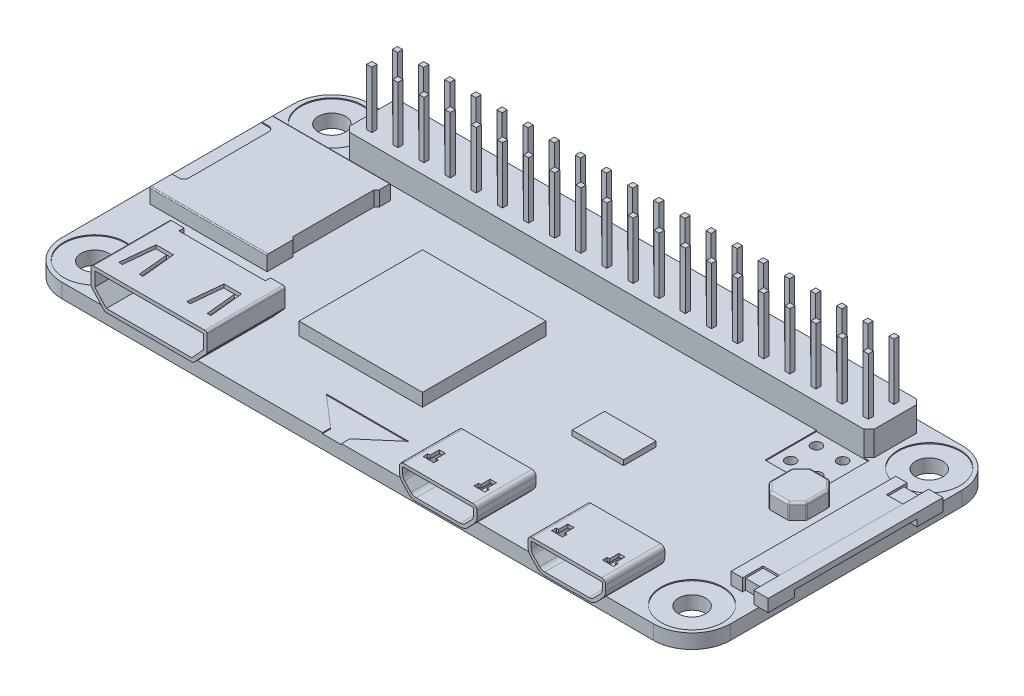
from build123d import *

# Parameters (mm, degrees)
BOSS_EXTRUDE1_DEPTH      = 1.4
SKETCH2_R                = 1.325
CUT_EXTRUDE1_DEPTH       = 36.821920663
SKETCH3_R                = 0.5
CUT_EXTRUDE2_DEPTH       = 36.821920663
LPATTERN1_COUNT          = 20
LPATTERN1_PITCH          = 2.54
SKETCH5_R                = 0.5
CUT_EXTRUDE4_DEPTH       = 36.821920663
SKETCH4_R                = 3
CUT_EXTRUDE3_DEPTH       = 0.1
SKETCH6_W                = 12
SKETCH6_H                = 12
BOSS_EXTRUDE2_DEPTH      = 1.25
BOSS_EXTRUDE3_DEPTH      = 1.45
FILLET2_R                = 0.1
CUT_EXTRUDE5_DEPTH       = 65.240816464
CUT_EXTRUDE5_DEPTH_BACK  = 9.5
SKETCH8_W                = 11.8
SKETCH8_H                = 1.25
BOSS_EXTRUDE4_DEPTH      = 0.4
BOSS_EXTRUDE4_DEPTH_BACK = 7.2
FILLET1_R                = 0.2
CUT_EXTRUDE6_DEPTH       = 7
SKETCH11_W               = 7
SKETCH11_H               = 0.55
BOSS_EXTRUDE5_DEPTH      = 3.5
CUT_EXTRUDE7_DEPTH       = 37.226130072
SKETCH13_W               = 8.4
SKETCH13_H               = 1.4
CUT_EXTRUDE8_DEPTH       = 0.5
BOSS_EXTRUDE6_DEPTH      = 1.25
BOSS_EXTRUDE6_DEPTH_BACK = 4.5
CUT_EXTRUDE9_DEPTH       = 5.25
SKETCH17_W               = 3.15
SKETCH17_H               = 0.4
BOSS_EXTRUDE7_DEPTH      = 3.5
CUT_EXTRUDE10_DEPTH      = 0.32
BOSS_EXTRUDE8_DEPTH      = 0.9
BOSS_EXTRUDE8_DEPTH_BACK = 0.5
BOSS_EXTRUDE9_DEPTH      = 1.19
SKETCH21_W               = 1.6
SKETCH21_H               = 1.7
BOSS_EXTRUDE10_DEPTH     = 1
SKETCH22_W               = 3.65
SKETCH22_H               = 4
BOSS_EXTRUDE11_DEPTH     = 1.5
CHAMFER1_SIZE            = 0.9
SKETCH23_W               = 5
SKETCH23_H               = 3.15
BOSS_EXTRUDE12_DEPTH     = 0.5
FILLET3_R                = 0.2
SKETCH_1_R               = 0.75
SKETCH_1_R_2             = 0.6
EXTRUDE_1_DEPTH          = 0.1
SKETCH_2_W               = 0.5
SKETCH_2_H               = 0.5
EXTRUDE_2_DEPTH          = 8
EXTRUDE_2_2_DEPTH        = 8
EXTRUDE_2_3_DEPTH        = 8
EXTRUDE_2_4_DEPTH        = 8
EXTRUDE_2_5_DEPTH        = 8
EXTRUDE_2_6_DEPTH        = 8
EXTRUDE_2_7_DEPTH        = 8
EXTRUDE_2_8_DEPTH        = 8
EXTRUDE_2_9_DEPTH        = 8
EXTRUDE_2_10_DEPTH       = 8
EXTRUDE_2_11_DEPTH       = 8
EXTRUDE_2_12_DEPTH       = 8
EXTRUDE_2_13_DEPTH       = 8
EXTRUDE_2_14_DEPTH       = 8
EXTRUDE_2_15_DEPTH       = 8
EXTRUDE_2_16_DEPTH       = 8
EXTRUDE_2_17_DEPTH       = 8
EXTRUDE_2_18_DEPTH       = 8
EXTRUDE_2_19_DEPTH       = 8
EXTRUDE_2_20_DEPTH       = 8
EXTRUDE_2_21_DEPTH       = 8
EXTRUDE_2_22_DEPTH       = 8
EXTRUDE_2_23_DEPTH       = 8
EXTRUDE_2_24_DEPTH       = 8
EXTRUDE_2_25_DEPTH       = 8
EXTRUDE_2_26_DEPTH       = 8
EXTRUDE_2_27_DEPTH       = 8
EXTRUDE_2_28_DEPTH       = 8
EXTRUDE_2_29_DEPTH       = 8
EXTRUDE_2_30_DEPTH       = 8
EXTRUDE_2_31_DEPTH       = 8
EXTRUDE_2_32_DEPTH       = 8
EXTRUDE_2_33_DEPTH       = 8
EXTRUDE_2_34_DEPTH       = 8
EXTRUDE_2_35_DEPTH       = 8
EXTRUDE_2_36_DEPTH       = 8
EXTRUDE_2_37_DEPTH       = 8
EXTRUDE_2_38_DEPTH       = 8
EXTRUDE_2_39_DEPTH       = 8
EXTRUDE_2_40_DEPTH       = 8
SKETCH_3_W               = 51
SKETCH_3_H               = 5.1
EXTRUDE_3_DEPTH          = 2.5
CHAMFER_1_SIZE           = 0.5


with BuildPart() as part:
    # Sketch1 → Boss-Extrude1 (new body)
    with BuildSketch(Plane(origin=(0, 0, 0), x_dir=(1, 0, 0), z_dir=(0, 1, 0))):
        with BuildLine():
            Line((-28.75, 15), (28.75, 15))
            ThreePointArc((28.75, 15), (31.401650429, 13.901650429), (32.5, 11.25))
            Line((32.5, 11.25), (32.5, -11.25))
            ThreePointArc((32.5, -11.25), (31.401650429, -13.901650429), (28.75, -15))
            Line((28.75, -15), (-28.75, -15))
            ThreePointArc((-28.75, -15), (-31.401650429, -13.901650429), (-32.5, -11.25))
            Line((-32.5, -11.25), (-32.5, 11.25))
            ThreePointArc((-32.5, 11.25), (-31.401650429, 13.901650429), (-28.75, 15))
        make_face()
    extrude(amount=BOSS_EXTRUDE1_DEPTH)

    # Sketch2 → Cut-Extrude1 (cut, through all)
    with BuildSketch(Plane(origin=(0, 1.4, 0), x_dir=(1, 0, 0), z_dir=(0, 1, 0))):
        with Locations(Location((-29.025, 11.525, 0), (0, 0, 270))):
            Circle(SKETCH2_R)
        with Locations(Location((29.025, 11.525, 0), (0, 0, 90))):
            Circle(SKETCH2_R)
        with Locations(Location((29.025, -11.525, 0), (0, 0, 270))):
            Circle(SKETCH2_R)
        with Locations(Location((-29.025, -11.525, 0), (0, 0, 90))):
            Circle(SKETCH2_R)
    extrude(amount=-CUT_EXTRUDE1_DEPTH, mode=Mode.SUBTRACT)

    # Sketch3 → Cut-Extrude2 (cut, through all)
    with BuildSketch(Plane(origin=(0, 1.4, 0), x_dir=(1, 0, 0), z_dir=(0, 1, 0))):
        with Locations(Location((-24.128, 13, 0), (0, 0, 270))):
            Circle(SKETCH3_R)
        with Locations(Location((-24.128, 10.5, 0), (0, 0, 270))):
            Circle(SKETCH3_R)
    cut_extrude2 = extrude(amount=-CUT_EXTRUDE2_DEPTH, mode=Mode.SUBTRACT)

    # LPattern1: Cut-Extrude2 ×20
    with Locations(*[(i * LPATTERN1_PITCH, 0, 0) for i in range(1, LPATTERN1_COUNT)]):
        add(cut_extrude2, mode=Mode.SUBTRACT)

    # Sketch5 → Cut-Extrude4 (cut, through all)
    with BuildSketch(Plane(origin=(0, 1.4, 0), x_dir=(1, 0, 0), z_dir=(0, 1, 0))):
        with Locations(Location((21.592, 5.5, 0), (0, 0, 270))):
            Circle(SKETCH5_R)
        with Locations(Location((24.132, 5.5, 0), (0, 0, 270))):
            Circle(SKETCH5_R)
        with Locations(Location((21.592, 8, 0), (0, 0, 270))):
            Circle(SKETCH5_R)
        with Locations(Location((24.132, 8, 0), (0, 0, 270))):
            Circle(SKETCH5_R)
    extrude(amount=-CUT_EXTRUDE4_DEPTH, mode=Mode.SUBTRACT)

    # Sketch4 → Cut-Extrude3 (cut)
    with BuildSketch(Plane(origin=(0, 1.4, 0), x_dir=(1, 0, 0), z_dir=(0, 1, 0))):
        with Locations(Location((-29.025, 11.525, 0), (0, 0, 270))):
            Circle(SKETCH4_R)
        with Locations(Location((-29.025, -11.525, 0), (0, 0, 270))):
            Circle(SKETCH4_R)
        with Locations(Location((29.025, -11.525, 0), (0, 0, 270))):
            Circle(SKETCH4_R)
        with Locations(Location((29.025, 11.525, 0), (0, 0, 270))):
            Circle(SKETCH4_R)
        Polygon((-25.5, 14.3), (25.5, 14.3), (25.5, 9.2), (25.5, 4.2), (20.4, 4.2), (20.4, 9.2), (-25.5, 9.2), align=None)
        Polygon((-6.5, -11.55), (1.5, -11.55), (-1.575, -14.2), (-1.575, -15), (-3.425, -15), (-3.425, -14.2), align=None)
    extrude(amount=-CUT_EXTRUDE3_DEPTH, mode=Mode.SUBTRACT)

    # Sketch6 → Boss-Extrude2 (add)
    with BuildSketch(Plane(origin=(0, 1.4, 0), x_dir=(1, 0, 0), z_dir=(0, 1, 0))):
        with Locations((-6.7, -2)):
            Rectangle(SKETCH6_W, SKETCH6_H)
    extrude(amount=BOSS_EXTRUDE2_DEPTH)

    # Sketch7 → Boss-Extrude3 (add)
    with BuildSketch(Plane(origin=(0, 1.4, 0), x_dir=(1, 0, 0), z_dir=(0, 1, 0))):
        with BuildLine():
            Line((-19.65, 7.85), (-19.65, 6.75))
            Line((-19.65, 6.75), (-19.9, 6.5))
            Line((-19.9, 6.5), (-19.9, -1.4))
            Line((-19.9, -1.4), (-19.65, -1.65))
            Line((-19.65, -1.65), (-19.65, -4.15))
            Line((-19.65, -4.15), (-31.05, -4.15))
            Line((-31.05, -4.15), (-31.05, -2))
            Line((-31.05, -2), (-30.4, -2))
            ThreePointArc((-30.4, -2), (-30.046446609, -1.853553391), (-29.9, -1.5))
            Line((-29.9, -1.5), (-29.9, 6.25))
            ThreePointArc((-29.9, 6.25), (-30.046446609, 6.603553391), (-30.4, 6.75))
            Line((-30.4, 6.75), (-31.05, 6.75))
            Line((-31.05, 6.75), (-31.05, 7.85))
            Line((-31.05, 7.85), (-19.65, 7.85))
        make_face()
    extrude(amount=BOSS_EXTRUDE3_DEPTH)

    # Fillet2
    fillet2_edges = [part.edges().sort_by_distance(p)[0] for p in [
        (-25.35, 2.85, 4.15),
        (-25.35, 2.85, -7.85),
    ]]
    fillet(fillet2_edges, radius=FILLET2_R)

    # Sketch8 → Cut-Extrude5 (cut, two sides: drawn at the far end of the back side and taken through both)
    with BuildSketch(Plane.ZY.offset(29.9).offset(-CUT_EXTRUDE5_DEPTH_BACK)):
        with Locations((-1.85, 2.125)):
            Rectangle(SKETCH8_W, SKETCH8_H)
    extrude(amount=CUT_EXTRUDE5_DEPTH + CUT_EXTRUDE5_DEPTH_BACK, mode=Mode.SUBTRACT)

    # Sketch15 → Boss-Extrude6 (add, two sides: drawn at the far end of the back side and taken through both)
    with BuildSketch(Plane.XY.offset(15).offset(-BOSS_EXTRUDE6_DEPTH_BACK)):
        with BuildLine():
            Line((18.2, 4), (24.95, 4))
            ThreePointArc((24.95, 4), (25.232842712, 3.882842712), (25.35, 3.6))
            Line((25.35, 3.6), (25.35, 3.052310288))
            ThreePointArc((25.35, 3.052310288), (25.277735771, 2.679072643), (25.071387321, 2.359778459))
            Line((25.071387321, 2.359778459), (24.445169445, 1.707468172))
            ThreePointArc((24.445169445, 1.707468172), (24.115871509, 1.480072876), (23.723782124, 1.4))
            Line((23.723782124, 1.4), (19.426217876, 1.4))
            ThreePointArc((19.426217876, 1.4), (19.034128491, 1.480072876), (18.704830555, 1.707468172))
            Line((18.704830555, 1.707468172), (18.078612679, 2.359778459))
            ThreePointArc((18.078612679, 2.359778459), (17.872264229, 2.679072643), (17.8, 3.052310288))
            Line((17.8, 3.052310288), (17.8, 3.6))
            ThreePointArc((17.8, 3.6), (17.917157288, 3.882842712), (18.2, 4))
        make_face()
        with BuildLine():
            Line((12.85, 3.6), (12.85, 3.052310288))
            ThreePointArc((12.85, 3.052310288), (12.777735771, 2.679072643), (12.571387321, 2.359778459))
            Line((12.571387321, 2.359778459), (11.945169445, 1.707468172))
            ThreePointArc((11.945169445, 1.707468172), (11.615871509, 1.480072876), (11.223782124, 1.4))
            Line((11.223782124, 1.4), (6.926217876, 1.4))
            ThreePointArc((6.926217876, 1.4), (6.534128491, 1.480072876), (6.204830555, 1.707468172))
            Line((6.204830555, 1.707468172), (5.578612679, 2.359778459))
            ThreePointArc((5.578612679, 2.359778459), (5.372264229, 2.679072643), (5.3, 3.052310288))
            Line((5.3, 3.052310288), (5.3, 3.6))
            ThreePointArc((5.3, 3.6), (5.417157288, 3.882842712), (5.7, 4))
            Line((5.7, 4), (12.45, 4))
            ThreePointArc((12.45, 4), (12.732842712, 3.882842712), (12.85, 3.6))
        make_face()
    extrude(amount=BOSS_EXTRUDE6_DEPTH + BOSS_EXTRUDE6_DEPTH_BACK)

    # Sketch16 → Cut-Extrude9 (cut)
    with BuildSketch(Plane.XY.offset(16.25)):
        with BuildLine():
            Line((12.45, 3.68), (5.7, 3.68))
            ThreePointArc((5.7, 3.68), (5.643431458, 3.656568542), (5.62, 3.6))
            Line((5.62, 3.6), (5.62, 3.052310288))
            ThreePointArc((5.62, 3.052310288), (5.669139676, 2.798508689), (5.809456622, 2.581388644))
            Line((5.809456622, 2.581388644), (6.435674498, 1.929078357))
            ThreePointArc((6.435674498, 1.929078357), (6.659597094, 1.774449555), (6.926217876, 1.72))
            Line((6.926217876, 1.72), (11.223782124, 1.72))
            ThreePointArc((11.223782124, 1.72), (11.490402906, 1.774449555), (11.714325502, 1.929078357))
            Line((11.714325502, 1.929078357), (12.340543378, 2.581388644))
            ThreePointArc((12.340543378, 2.581388644), (12.480860324, 2.798508689), (12.53, 3.052310288))
            Line((12.53, 3.052310288), (12.53, 3.6))
            ThreePointArc((12.53, 3.6), (12.506568542, 3.656568542), (12.45, 3.68))
        make_face()
        with BuildLine():
            Line((24.214325502, 1.929078357), (24.840543378, 2.581388644))
            ThreePointArc((24.840543378, 2.581388644), (24.980860324, 2.798508689), (25.03, 3.052310288))
            Line((25.03, 3.052310288), (25.03, 3.6))
            ThreePointArc((25.03, 3.6), (25.006568542, 3.656568542), (24.95, 3.68))
            Line((24.95, 3.68), (18.2, 3.68))
            ThreePointArc((18.2, 3.68), (18.143431458, 3.656568542), (18.12, 3.6))
            Line((18.12, 3.6), (18.12, 3.052310288))
            ThreePointArc((18.12, 3.052310288), (18.169139676, 2.798508689), (18.309456622, 2.581388644))
            Line((18.309456622, 2.581388644), (18.935674498, 1.929078357))
            ThreePointArc((18.935674498, 1.929078357), (19.159597094, 1.774449555), (19.426217876, 1.72))
            Line((19.426217876, 1.72), (23.723782124, 1.72))
            ThreePointArc((23.723782124, 1.72), (23.990402906, 1.774449555), (24.214325502, 1.929078357))
        make_face()
    extrude(amount=-CUT_EXTRUDE9_DEPTH, mode=Mode.SUBTRACT)

    # Sketch17 → Boss-Extrude7 (add)
    with BuildSketch(Plane.XY.offset(11)):
        with Locations((9.075, 3.12)):
            Rectangle(SKETCH17_W, SKETCH17_H)
        with Locations((21.575, 3.12)):
            Rectangle(SKETCH17_W, SKETCH17_H)
    extrude(amount=BOSS_EXTRUDE7_DEPTH)

    # Sketch18 → Cut-Extrude10 (cut)
    with BuildSketch(Plane(origin=(0, 4, 0), x_dir=(1, 0, 0), z_dir=(0, 1, 0))):
        Polygon((6.9, -13.37), (6.3, -13.37), (6.3, -14.27), (6.075, -14.27), (6.075, -14.72), (7.125, -14.72), (7.125, -14.27), (6.9, -14.27), align=None)
        Polygon((11.25, -13.37), (11.25, -14.27), (11.025, -14.27), (11.025, -14.72), (12.075, -14.72), (12.075, -14.27), (11.85, -14.27), (11.85, -13.37), align=None)
        Polygon((19.4, -13.37), (18.8, -13.37), (18.8, -14.27), (18.575, -14.27), (18.575, -14.72), (19.625, -14.72), (19.625, -14.27), (19.4, -14.27), align=None)
        Polygon((23.75, -13.37), (23.75, -14.27), (23.525, -14.27), (23.525, -14.72), (24.575, -14.72), (24.575, -14.27), (24.35, -14.27), (24.35, -13.37), align=None)
    extrude(amount=-CUT_EXTRUDE10_DEPTH, mode=Mode.SUBTRACT)

    # Sketch19 → Boss-Extrude8 (add, two sides: drawn at the far end of the back side and taken through both)
    with BuildSketch(Plane(origin=(32.5, 0, 0), x_dir=(0, 0, -1), z_dir=(1, 0, 0)).offset(-BOSS_EXTRUDE8_DEPTH_BACK)):
        Polygon((-8.5, 2.6), (8.5, 2.6), (8.5, 1.4), (5.95, 1.4), (5.95, 2.05), (-5.95, 2.05), (-5.95, 1.4), (-8.5, 1.4), align=None)
    extrude(amount=BOSS_EXTRUDE8_DEPTH + BOSS_EXTRUDE8_DEPTH_BACK)

    # Sketch20 → Boss-Extrude9 (add)
    with BuildSketch(Plane(origin=(0, 1.4, 0), x_dir=(1, 0, 0), z_dir=(0, 1, 0))):
        Polygon((32, 6), (30.4, 6), (30.4, 8), (29.3, 8), (29.3, -8), (30.4, -8), (30.4, -6), (32, -6), align=None)
    extrude(amount=BOSS_EXTRUDE9_DEPTH)

    # Sketch21 → Boss-Extrude10 (add)
    with BuildSketch(Plane(origin=(0, 1.4, 0), x_dir=(1, 0, 0), z_dir=(0, 1, 0))):
        with Locations((31.2, 6.85)):
            Rectangle(SKETCH21_W, SKETCH21_H)
        with Locations((31.2, -6.85)):
            Rectangle(SKETCH21_W, SKETCH21_H)
    extrude(amount=BOSS_EXTRUDE10_DEPTH)

    # Sketch22 → Boss-Extrude11 (add)
    with BuildSketch(Plane(origin=(0, 1.4, 0), x_dir=(1, 0, 0), z_dir=(0, 1, 0))):
        with Locations((25.675, 2.25)):
            Rectangle(SKETCH22_W, SKETCH22_H)
    extrude(amount=BOSS_EXTRUDE11_DEPTH)

    # Chamfer1
    # the kernel refuses this chamfer: 0.9 mm, written as the material it takes off along each edge
    with BuildSketch(Plane(origin=(23.85, 1.4, -4.25), x_dir=(0.9996219169112966, 0, -0.027495876610586487), z_dir=(0, 1, 0))) as chamfer1_piece_1:
        Polygon((CHAMFER1_SIZE * 0.999621916911, -CHAMFER1_SIZE * 0.0274958766106), (-CHAMFER1_SIZE * 0.0274958766106, -CHAMFER1_SIZE * 0.999621916911), (0, 0), align=None)
    extrude(amount=3.814514689, mode=Mode.SUBTRACT)
    with BuildSketch(Plane(origin=(23.85, 1.4, -0.25), x_dir=(0.9996219169112966, 0, 0.027495876610586487), z_dir=(0, 1, 0)), Plane(origin=(27.5, 1.4, -0.25), x_dir=(0.027495876610584467, 0, -0.9996219169112966), z_dir=(0, 1, 0)), Plane(origin=(27.5, 1.4, -4.25), x_dir=(-0.9996219169112966, 0, -0.027495876610586487), z_dir=(0, 1, 0))) as chamfer1_piece_2:
        Polygon((CHAMFER1_SIZE * 0.999621916911, CHAMFER1_SIZE * 0.0274958766106), (-CHAMFER1_SIZE * 0.0274958766106, CHAMFER1_SIZE * 0.999621916911), (0, 0), align=None)
    extrude(amount=3.814514689, mode=Mode.SUBTRACT)

    # Sketch23 → Boss-Extrude12 (add)
    with BuildSketch(Plane(origin=(0, 1.4, 0), x_dir=(1, 0, 0), z_dir=(0, 1, 0))):
        with Locations((11.5, -1.575)):
            Rectangle(SKETCH23_W, SKETCH23_H)
    extrude(amount=BOSS_EXTRUDE12_DEPTH)

    # Fillet3
    # the kernel refuses this fillet: 0.2 mm, written as the material it takes off along each edge
    with BuildSketch(Plane(origin=(24.05, 2.7, -1.232842712), x_dir=(-1, 0, 0), z_dir=(0, 1, 0))) as fillet3_piece_1_section:
        Polygon((0, 0), (FILLET3_R, 0), (FILLET3_R, FILLET3_R * 0.414213562373), (FILLET3_R * 0.707106781187, FILLET3_R * 0.707106781186), align=None)
    fillet3_piece_1 = extrude(amount=FILLET3_R, mode=Mode.PRIVATE)
    fillet3_piece_1 = fillet3_piece_1 - Plane(origin=(24.05, 2.7, -1.232842712), x_dir=(0.9238795325113632, 0, -0.38268343236490504), z_dir=(0, 1, 0)) * Sphere(FILLET3_R, mode=Mode.PRIVATE)
    add(fillet3_piece_1, mode=Mode.SUBTRACT)
    with BuildSketch(Plane(origin=(24.05, 2.7, -3.267157288), x_dir=(-0.7071067811868302, 0, -0.7071067811862648), z_dir=(0, 1, 0))) as fillet3_piece_2_section:
        Polygon((0, 0), (FILLET3_R, 0), (FILLET3_R, FILLET3_R * 0.414213562373), (FILLET3_R * 0.707106781187, FILLET3_R * 0.707106781186), align=None)
    fillet3_piece_2 = extrude(amount=FILLET3_R, mode=Mode.PRIVATE)
    fillet3_piece_2 = fillet3_piece_2 - Plane(origin=(24.05, 2.7, -3.267157288), x_dir=(0.9238795325113632, 0, 0.38268343236490504), z_dir=(0, 1, 0)) * Sphere(FILLET3_R, mode=Mode.PRIVATE)
    add(fillet3_piece_2, mode=Mode.SUBTRACT)
    with BuildSketch(Plane(origin=(24.832842712, 2.7, -4.05), x_dir=(0, 0, -1), z_dir=(0, 1, 0))) as fillet3_piece_3_section:
        Polygon((0, 0), (FILLET3_R, 0), (FILLET3_R, FILLET3_R * 0.414213562373), (FILLET3_R * 0.707106781186, FILLET3_R * 0.707106781187), align=None)
    fillet3_piece_3 = extrude(amount=FILLET3_R, mode=Mode.PRIVATE)
    fillet3_piece_3 = fillet3_piece_3 - Plane(origin=(24.832842712, 2.7, -4.05), x_dir=(0.38268343236527447, 0, 0.9238795325112102), z_dir=(0, 1, 0)) * Sphere(FILLET3_R, mode=Mode.PRIVATE)
    add(fillet3_piece_3, mode=Mode.SUBTRACT)
    with BuildSketch(Plane(origin=(26.517157288, 2.7, -4.05), x_dir=(0, 0, -1), z_dir=(0, 1, 0))) as fillet3_piece_4_section:
        Polygon((0, 0), (FILLET3_R, 0), (FILLET3_R, -FILLET3_R * 0.414213562373), (FILLET3_R * 0.707106781186, -FILLET3_R * 0.707106781187), align=None)
    fillet3_piece_4 = extrude(amount=FILLET3_R, mode=Mode.PRIVATE)
    fillet3_piece_4 = fillet3_piece_4 - Plane(origin=(26.517157288, 2.7, -4.05), x_dir=(-0.38268343236527447, 0, 0.9238795325112102), z_dir=(0, 1, 0)) * Sphere(FILLET3_R, mode=Mode.PRIVATE)
    add(fillet3_piece_4, mode=Mode.SUBTRACT)
    with BuildSketch(Plane(origin=(26.517157288, 2.7, -0.45), x_dir=(0, 0, 1), z_dir=(0, 1, 0))) as fillet3_piece_5_section:
        Polygon((0, 0), (FILLET3_R, 0), (FILLET3_R, FILLET3_R * 0.414213562373), (FILLET3_R * 0.707106781187, FILLET3_R * 0.707106781186), align=None)
    fillet3_piece_5 = extrude(amount=FILLET3_R, mode=Mode.PRIVATE)
    fillet3_piece_5 = fillet3_piece_5 - Plane(origin=(26.517157288, 2.7, -0.45), x_dir=(-0.3826834323649051, 0, -0.9238795325113633), z_dir=(0, 1, 0)) * Sphere(FILLET3_R, mode=Mode.PRIVATE)
    add(fillet3_piece_5, mode=Mode.SUBTRACT)
    with BuildSketch(Plane(origin=(24.832842712, 2.7, -0.45), x_dir=(0, 0, 1), z_dir=(0, 1, 0))) as fillet3_piece_6_section:
        Polygon((0, 0), (FILLET3_R, 0), (FILLET3_R, -FILLET3_R * 0.414213562373), (FILLET3_R * 0.707106781186, -FILLET3_R * 0.707106781187), align=None)
    fillet3_piece_6 = extrude(amount=FILLET3_R, mode=Mode.PRIVATE)
    fillet3_piece_6 = fillet3_piece_6 - Plane(origin=(24.832842712, 2.7, -0.45), x_dir=(0.38268343236527447, 0, -0.9238795325112102), z_dir=(0, 1, 0)) * Sphere(FILLET3_R, mode=Mode.PRIVATE)
    add(fillet3_piece_6, mode=Mode.SUBTRACT)
    with BuildSketch(Plane(origin=(27.3, 2.7, -3.267157288), x_dir=(0.7071067811868302, 0, -0.7071067811862648), z_dir=(0, 1, 0))) as fillet3_piece_7_section:
        Polygon((0, 0), (FILLET3_R, 0), (FILLET3_R, -FILLET3_R * 0.414213562373), (FILLET3_R * 0.707106781187, -FILLET3_R * 0.707106781186), align=None)
    fillet3_piece_7 = extrude(amount=FILLET3_R, mode=Mode.PRIVATE)
    fillet3_piece_7 = fillet3_piece_7 - Plane(origin=(27.3, 2.7, -3.267157288), x_dir=(-0.9238795325113632, 0, 0.38268343236490504), z_dir=(0, 1, 0)) * Sphere(FILLET3_R, mode=Mode.PRIVATE)
    add(fillet3_piece_7, mode=Mode.SUBTRACT)
    with BuildSketch(Plane(origin=(27.3, 2.7, -1.232842712), x_dir=(1, 0, 0), z_dir=(0, 1, 0))) as fillet3_piece_8_section:
        Polygon((0, 0), (FILLET3_R, 0), (FILLET3_R, -FILLET3_R * 0.414213562373), (FILLET3_R * 0.707106781186, -FILLET3_R * 0.707106781187), align=None)
    fillet3_piece_8 = extrude(amount=FILLET3_R, mode=Mode.PRIVATE)
    fillet3_piece_8 = fillet3_piece_8 - Plane(origin=(27.3, 2.7, -1.232842712), x_dir=(-0.9238795325112102, 0, -0.38268343236527447), z_dir=(0, 1, 0)) * Sphere(FILLET3_R, mode=Mode.PRIVATE)
    add(fillet3_piece_8, mode=Mode.SUBTRACT)
    with BuildSketch(Plane(origin=(23.85, 2.9, -1.232842712), x_dir=(0, -1, 0), z_dir=(0, 0, -1)), Plane(origin=(27.5, 2.9, -3.267157288), x_dir=(0, -1, 0), z_dir=(0, 0, 1))) as fillet3_piece_9:
        with BuildLine():
            CenterArc((FILLET3_R, -FILLET3_R), FILLET3_R, 90, 90)
            Line((0, -FILLET3_R), (0, 0))
            Line((0, 0), (FILLET3_R, 0))
        make_face()
    extrude(amount=2.034314575, mode=Mode.SUBTRACT)
    with BuildSketch(Plane(origin=(23.85, 1.4, -1.15), x_dir=(-4.331389821029687e-12, 0, -1.0), z_dir=(0, 1, 0)), Plane(origin=(23.85, 1.4, -3.35), x_dir=(0.7071067811862634, 0, -0.7071067811868317), z_dir=(0, 1, 0)), Plane(origin=(24.75, 1.4, -4.25), x_dir=(1.0, 0, 4.299226035225122e-12), z_dir=(0, 1, 0))) as fillet3_piece_10:
        with BuildLine():
            CenterArc((FILLET3_R * 0.414213562369, -FILLET3_R), FILLET3_R, 90, 45)
            Line((-FILLET3_R * 0.292893218816, -FILLET3_R * 0.292893218811), (0, 0))
            Line((0, 0), (FILLET3_R * 0.414213562373, 0))
        make_face()
    extrude(amount=1.3, mode=Mode.SUBTRACT)
    with BuildSketch(Plane(origin=(24.832842712, 2.9, -4.25), x_dir=(0, -1, 0), z_dir=(1, 0, 0)), Plane(origin=(26.517157288, 2.9, -0.25), x_dir=(0, -1, 0), z_dir=(-1, 0, 0))) as fillet3_piece_11:
        with BuildLine():
            CenterArc((FILLET3_R, -FILLET3_R), FILLET3_R, 90, 90)
            Line((0, -FILLET3_R), (0, 0))
            Line((0, 0), (FILLET3_R, 0))
        make_face()
    extrude(amount=1.684314575, mode=Mode.SUBTRACT)
    with BuildSketch(Plane(origin=(26.6, 1.4, -4.25), x_dir=(-1.0, 0, 4.299226035225122e-12), z_dir=(0, 1, 0)), Plane(origin=(27.5, 1.4, -1.15), x_dir=(-4.331389821024788e-12, 0, -1.0), z_dir=(0, 1, 0)), Plane(origin=(27.5, 1.4, -3.35), x_dir=(-0.7071067811862634, 0, -0.7071067811868317), z_dir=(0, 1, 0)), Plane(origin=(24.75, 1.4, -0.25), x_dir=(1.0, 0, -4.38801148560968e-12), z_dir=(0, 1, 0)), Plane(origin=(26.6, 1.4, -0.25), x_dir=(0.7071067811868266, 0, -0.7071067811862685), z_dir=(0, 1, 0))) as fillet3_piece_12:
        with BuildLine():
            CenterArc((FILLET3_R * 0.414213562378, FILLET3_R), FILLET3_R, 225, 45)
            Line((-FILLET3_R * 0.292893218811, FILLET3_R * 0.292893218816), (0, 0))
            Line((0, 0), (FILLET3_R * 0.414213562373, 0))
        make_face()
    extrude(amount=1.3, mode=Mode.SUBTRACT)
    with BuildSketch(Plane(origin=(24.691421356, 2.9, -0.308578644), x_dir=(0, -1, 0), z_dir=(-0.7071067811862648, 0, -0.7071067811868302)), Plane(origin=(27.441421356, 2.9, -1.091421356), x_dir=(0, -1, 0), z_dir=(-0.7071067811868302, 0, 0.7071067811862648)), Plane(origin=(26.658578644, 2.9, -4.191421356), x_dir=(0, -1, 0), z_dir=(0.7071067811862648, 0, 0.7071067811868302))) as fillet3_piece_13:
        with BuildLine():
            CenterArc((FILLET3_R, -FILLET3_R), FILLET3_R, 90, 90)
            Line((0, -FILLET3_R), (0, 0))
            Line((0, 0), (FILLET3_R, 0))
        make_face()
    extrude(amount=1.107106781, mode=Mode.SUBTRACT)
    with BuildSketch(Plane(origin=(24.691421356, 2.9, -4.191421356), x_dir=(0, -1, 0), z_dir=(-0.7071067811862648, 0, 0.7071067811868302))) as fillet3_piece_14:
        with BuildLine():
            CenterArc((FILLET3_R, FILLET3_R), FILLET3_R, 180, 90)
            Line((0, FILLET3_R), (0, 0))
            Line((0, 0), (FILLET3_R, 0))
        make_face()
    extrude(amount=1.107106781, mode=Mode.SUBTRACT)

    # 草图1 → 凸台-拉伸1 (add)
    with BuildSketch(Plane.XZ):
        with Locations(Location((22.059044148, 8.883324517, 0), (0, 0, 90))):
            Circle(SKETCH_1_R)
        with Locations(Location((22.059044148, 11.173176165, 0), (0, 0, 90))):
            Circle(SKETCH_1_R)
        with Locations(Location((8.324578667, 12.898148812, 0), (0, 0, 90))):
            Circle(SKETCH_1_R_2)
        with Locations(Location((10.197519327, 12.898148812, 0), (0, 0, 90))):
            Circle(SKETCH_1_R_2)
    extrude(amount=EXTRUDE_1_DEPTH)



with BuildPart() as body_2:
    # Sketch9 → Boss-Extrude4 (new, two sides: drawn at the far end of the back side and taken through both)
    with BuildSketch(Plane.XY.offset(15).offset(-BOSS_EXTRUDE4_DEPTH_BACK)):
        Polygon((-25.5, 4.7), (-14.25, 4.7), (-14.25, 2.85), (-15.575, 1.4), (-24.175, 1.4), (-25.5, 2.85), align=None)
    extrude(amount=BOSS_EXTRUDE4_DEPTH + BOSS_EXTRUDE4_DEPTH_BACK)

    # Fillet1
    fillet1_edges = [body_2.edges().sort_by_distance(p)[0] for p in [
        (-25.5, 4.7, 11.6),
        (-14.25, 4.7, 11.6),
        (-14.25, 2.85, 11.6),
        (-15.575, 1.4, 11.6),
        (-24.175, 1.4, 11.6),
        (-25.5, 2.85, 11.6),
    ]]
    fillet(fillet1_edges, radius=FILLET1_R)

    # Sketch10 → Cut-Extrude6 (cut)
    with BuildSketch(Plane.XY.offset(15.4)):
        Polygon((-25.15, 4.35), (-25.15, 2.985829331), (-24.020707681, 1.75), (-15.729292319, 1.75), (-14.6, 2.985829331), (-14.6, 4.35), align=None)
    extrude(amount=-CUT_EXTRUDE6_DEPTH, mode=Mode.SUBTRACT)

    # Sketch11 → Boss-Extrude5 (add)
    with BuildSketch(Plane.XY.offset(8.4)):
        with Locations((-19.875, 3.225)):
            Rectangle(SKETCH11_W, SKETCH11_H)
    extrude(amount=BOSS_EXTRUDE5_DEPTH)

    # Sketch12 → Cut-Extrude7 (cut, through all)
    with BuildSketch(Plane.XZ.offset(-4.35)):
        Polygon((-24.025, 10.57), (-22.325, 10.57), (-22, 13.87), (-22.351693275, 13.87), (-22.642223578, 10.92), (-23.707776422, 10.92), (-23.998306725, 13.87), (-24.35, 13.87), align=None)
        Polygon((-15.725, 10.57), (-15.4, 13.87), (-15.751693275, 13.87), (-16.042223578, 10.92), (-17.107776422, 10.92), (-17.398306725, 13.87), (-17.75, 13.87), (-17.425, 10.57), align=None)
    extrude(amount=-CUT_EXTRUDE7_DEPTH, mode=Mode.SUBTRACT)

    # Sketch13 → Cut-Extrude8 (cut)
    with BuildSketch(Plane(origin=(0, 0, 7.8), x_dir=(-1, 0, 0), z_dir=(0, 0, -1))):
        with Locations((19.875, 4)):
            Rectangle(SKETCH13_W, SKETCH13_H)
    extrude(amount=-CUT_EXTRUDE8_DEPTH, mode=Mode.SUBTRACT)


with BuildPart() as body_3:
    # 草图2 → 凸台-拉伸2 (new body)
    with BuildSketch(Plane(origin=(0, 1.3, 0), x_dir=(1, 0, 0), z_dir=(0, 1, 0))):
        with Locations((-21.588, 13)):
            Rectangle(SKETCH_2_W, SKETCH_2_H)
    extrude(amount=EXTRUDE_2_DEPTH)


with BuildPart() as body_4:
    # 草图2 → Extrude 2 2 (new body)
    with BuildSketch(Plane(origin=(0, 1.3, 0), x_dir=(1, 0, 0), z_dir=(0, 1, 0))):
        with Locations((-24.128, 13)):
            Rectangle(SKETCH_2_W, SKETCH_2_H)
    extrude(amount=EXTRUDE_2_2_DEPTH)


with BuildPart() as body_5:
    # 草图2 → Extrude 2 3 (new body)
    with BuildSketch(Plane(origin=(0, 1.3, 0), x_dir=(1, 0, 0), z_dir=(0, 1, 0))):
        with Locations((-19.048, 13)):
            Rectangle(SKETCH_2_W, SKETCH_2_H)
    extrude(amount=EXTRUDE_2_3_DEPTH)


with BuildPart() as body_6:
    # 草图2 → Extrude 2 4 (new body)
    with BuildSketch(Plane(origin=(0, 1.3, 0), x_dir=(1, 0, 0), z_dir=(0, 1, 0))):
        with Locations((-16.508, 13)):
            Rectangle(SKETCH_2_W, SKETCH_2_H)
    extrude(amount=EXTRUDE_2_4_DEPTH)


with BuildPart() as body_7:
    # 草图2 → Extrude 2 5 (new body)
    with BuildSketch(Plane(origin=(0, 1.3, 0), x_dir=(1, 0, 0), z_dir=(0, 1, 0))):
        with Locations((-13.968, 13)):
            Rectangle(SKETCH_2_W, SKETCH_2_H)
    extrude(amount=EXTRUDE_2_5_DEPTH)


with BuildPart() as body_8:
    # 草图2 → Extrude 2 6 (new body)
    with BuildSketch(Plane(origin=(0, 1.3, 0), x_dir=(1, 0, 0), z_dir=(0, 1, 0))):
        with Locations((-11.428, 13)):
            Rectangle(SKETCH_2_W, SKETCH_2_H)
    extrude(amount=EXTRUDE_2_6_DEPTH)


with BuildPart() as body_9:
    # 草图2 → Extrude 2 7 (new body)
    with BuildSketch(Plane(origin=(0, 1.3, 0), x_dir=(1, 0, 0), z_dir=(0, 1, 0))):
        with Locations((-8.888, 13)):
            Rectangle(SKETCH_2_W, SKETCH_2_H)
    extrude(amount=EXTRUDE_2_7_DEPTH)


with BuildPart() as body_10:
    # 草图2 → Extrude 2 8 (new body)
    with BuildSketch(Plane(origin=(0, 1.3, 0), x_dir=(1, 0, 0), z_dir=(0, 1, 0))):
        with Locations((-6.348, 13)):
            Rectangle(SKETCH_2_W, SKETCH_2_H)
    extrude(amount=EXTRUDE_2_8_DEPTH)


with BuildPart() as body_11:
    # 草图2 → Extrude 2 9 (new body)
    with BuildSketch(Plane(origin=(0, 1.3, 0), x_dir=(1, 0, 0), z_dir=(0, 1, 0))):
        with Locations((-3.808, 13)):
            Rectangle(SKETCH_2_W, SKETCH_2_H)
    extrude(amount=EXTRUDE_2_9_DEPTH)


with BuildPart() as body_12:
    # 草图2 → Extrude 2 10 (new body)
    with BuildSketch(Plane(origin=(0, 1.3, 0), x_dir=(1, 0, 0), z_dir=(0, 1, 0))):
        with Locations((-1.268, 13)):
            Rectangle(SKETCH_2_W, SKETCH_2_H)
    extrude(amount=EXTRUDE_2_10_DEPTH)


with BuildPart() as body_13:
    # 草图2 → Extrude 2 11 (new body)
    with BuildSketch(Plane(origin=(0, 1.3, 0), x_dir=(1, 0, 0), z_dir=(0, 1, 0))):
        with Locations((1.272, 13)):
            Rectangle(SKETCH_2_W, SKETCH_2_H)
    extrude(amount=EXTRUDE_2_11_DEPTH)


with BuildPart() as body_14:
    # 草图2 → Extrude 2 12 (new body)
    with BuildSketch(Plane(origin=(0, 1.3, 0), x_dir=(1, 0, 0), z_dir=(0, 1, 0))):
        with Locations((3.812, 13)):
            Rectangle(SKETCH_2_W, SKETCH_2_H)
    extrude(amount=EXTRUDE_2_12_DEPTH)


with BuildPart() as body_15:
    # 草图2 → Extrude 2 13 (new body)
    with BuildSketch(Plane(origin=(0, 1.3, 0), x_dir=(1, 0, 0), z_dir=(0, 1, 0))):
        with Locations((6.352, 13)):
            Rectangle(SKETCH_2_W, SKETCH_2_H)
    extrude(amount=EXTRUDE_2_13_DEPTH)


with BuildPart() as body_16:
    # 草图2 → Extrude 2 14 (new body)
    with BuildSketch(Plane(origin=(0, 1.3, 0), x_dir=(1, 0, 0), z_dir=(0, 1, 0))):
        with Locations((8.892, 13)):
            Rectangle(SKETCH_2_W, SKETCH_2_H)
    extrude(amount=EXTRUDE_2_14_DEPTH)


with BuildPart() as body_17:
    # 草图2 → Extrude 2 15 (new body)
    with BuildSketch(Plane(origin=(0, 1.3, 0), x_dir=(1, 0, 0), z_dir=(0, 1, 0))):
        with Locations((11.432, 13)):
            Rectangle(SKETCH_2_W, SKETCH_2_H)
    extrude(amount=EXTRUDE_2_15_DEPTH)


with BuildPart() as body_18:
    # 草图2 → Extrude 2 16 (new body)
    with BuildSketch(Plane(origin=(0, 1.3, 0), x_dir=(1, 0, 0), z_dir=(0, 1, 0))):
        with Locations((13.972, 13)):
            Rectangle(SKETCH_2_W, SKETCH_2_H)
    extrude(amount=EXTRUDE_2_16_DEPTH)


with BuildPart() as body_19:
    # 草图2 → Extrude 2 17 (new body)
    with BuildSketch(Plane(origin=(0, 1.3, 0), x_dir=(1, 0, 0), z_dir=(0, 1, 0))):
        with Locations((16.512, 13)):
            Rectangle(SKETCH_2_W, SKETCH_2_H)
    extrude(amount=EXTRUDE_2_17_DEPTH)


with BuildPart() as body_20:
    # 草图2 → Extrude 2 18 (new body)
    with BuildSketch(Plane(origin=(0, 1.3, 0), x_dir=(1, 0, 0), z_dir=(0, 1, 0))):
        with Locations((19.052, 13)):
            Rectangle(SKETCH_2_W, SKETCH_2_H)
    extrude(amount=EXTRUDE_2_18_DEPTH)


with BuildPart() as body_21:
    # 草图2 → Extrude 2 19 (new body)
    with BuildSketch(Plane(origin=(0, 1.3, 0), x_dir=(1, 0, 0), z_dir=(0, 1, 0))):
        with Locations((21.592, 13)):
            Rectangle(SKETCH_2_W, SKETCH_2_H)
    extrude(amount=EXTRUDE_2_19_DEPTH)


with BuildPart() as body_22:
    # 草图2 → Extrude 2 20 (new body)
    with BuildSketch(Plane(origin=(0, 1.3, 0), x_dir=(1, 0, 0), z_dir=(0, 1, 0))):
        with Locations((24.132, 13)):
            Rectangle(SKETCH_2_W, SKETCH_2_H)
    extrude(amount=EXTRUDE_2_20_DEPTH)


with BuildPart() as body_23:
    # 草图2 → Extrude 2 21 (new body)
    with BuildSketch(Plane(origin=(0, 1.3, 0), x_dir=(1, 0, 0), z_dir=(0, 1, 0))):
        with Locations((-21.588, 10.5)):
            Rectangle(SKETCH_2_W, SKETCH_2_H)
    extrude(amount=EXTRUDE_2_21_DEPTH)


with BuildPart() as body_24:
    # 草图2 → Extrude 2 22 (new body)
    with BuildSketch(Plane(origin=(0, 1.3, 0), x_dir=(1, 0, 0), z_dir=(0, 1, 0))):
        with Locations((-19.048, 10.5)):
            Rectangle(SKETCH_2_W, SKETCH_2_H)
    extrude(amount=EXTRUDE_2_22_DEPTH)


with BuildPart() as body_25:
    # 草图2 → Extrude 2 23 (new body)
    with BuildSketch(Plane(origin=(0, 1.3, 0), x_dir=(1, 0, 0), z_dir=(0, 1, 0))):
        with Locations((-16.508, 10.5)):
            Rectangle(SKETCH_2_W, SKETCH_2_H)
    extrude(amount=EXTRUDE_2_23_DEPTH)


with BuildPart() as body_26:
    # 草图2 → Extrude 2 24 (new body)
    with BuildSketch(Plane(origin=(0, 1.3, 0), x_dir=(1, 0, 0), z_dir=(0, 1, 0))):
        with Locations((-13.968, 10.5)):
            Rectangle(SKETCH_2_W, SKETCH_2_H)
    extrude(amount=EXTRUDE_2_24_DEPTH)


with BuildPart() as body_27:
    # 草图2 → Extrude 2 25 (new body)
    with BuildSketch(Plane(origin=(0, 1.3, 0), x_dir=(1, 0, 0), z_dir=(0, 1, 0))):
        with Locations((-11.428, 10.5)):
            Rectangle(SKETCH_2_W, SKETCH_2_H)
    extrude(amount=EXTRUDE_2_25_DEPTH)


with BuildPart() as body_28:
    # 草图2 → Extrude 2 26 (new body)
    with BuildSketch(Plane(origin=(0, 1.3, 0), x_dir=(1, 0, 0), z_dir=(0, 1, 0))):
        with Locations((-8.888, 10.5)):
            Rectangle(SKETCH_2_W, SKETCH_2_H)
    extrude(amount=EXTRUDE_2_26_DEPTH)


with BuildPart() as body_29:
    # 草图2 → Extrude 2 27 (new body)
    with BuildSketch(Plane(origin=(0, 1.3, 0), x_dir=(1, 0, 0), z_dir=(0, 1, 0))):
        with Locations((-6.348, 10.5)):
            Rectangle(SKETCH_2_W, SKETCH_2_H)
    extrude(amount=EXTRUDE_2_27_DEPTH)


with BuildPart() as body_30:
    # 草图2 → Extrude 2 28 (new body)
    with BuildSketch(Plane(origin=(0, 1.3, 0), x_dir=(1, 0, 0), z_dir=(0, 1, 0))):
        with Locations((-3.808, 10.5)):
            Rectangle(SKETCH_2_W, SKETCH_2_H)
    extrude(amount=EXTRUDE_2_28_DEPTH)


with BuildPart() as body_31:
    # 草图2 → Extrude 2 29 (new body)
    with BuildSketch(Plane(origin=(0, 1.3, 0), x_dir=(1, 0, 0), z_dir=(0, 1, 0))):
        with Locations((-1.268, 10.5)):
            Rectangle(SKETCH_2_W, SKETCH_2_H)
    extrude(amount=EXTRUDE_2_29_DEPTH)


with BuildPart() as body_32:
    # 草图2 → Extrude 2 30 (new body)
    with BuildSketch(Plane(origin=(0, 1.3, 0), x_dir=(1, 0, 0), z_dir=(0, 1, 0))):
        with Locations((1.272, 10.5)):
            Rectangle(SKETCH_2_W, SKETCH_2_H)
    extrude(amount=EXTRUDE_2_30_DEPTH)


with BuildPart() as body_33:
    # 草图2 → Extrude 2 31 (new body)
    with BuildSketch(Plane(origin=(0, 1.3, 0), x_dir=(1, 0, 0), z_dir=(0, 1, 0))):
        with Locations((3.812, 10.5)):
            Rectangle(SKETCH_2_W, SKETCH_2_H)
    extrude(amount=EXTRUDE_2_31_DEPTH)


with BuildPart() as body_34:
    # 草图2 → Extrude 2 32 (new body)
    with BuildSketch(Plane(origin=(0, 1.3, 0), x_dir=(1, 0, 0), z_dir=(0, 1, 0))):
        with Locations((6.352, 10.5)):
            Rectangle(SKETCH_2_W, SKETCH_2_H)
    extrude(amount=EXTRUDE_2_32_DEPTH)


with BuildPart() as body_35:
    # 草图2 → Extrude 2 33 (new body)
    with BuildSketch(Plane(origin=(0, 1.3, 0), x_dir=(1, 0, 0), z_dir=(0, 1, 0))):
        with Locations((8.892, 10.5)):
            Rectangle(SKETCH_2_W, SKETCH_2_H)
    extrude(amount=EXTRUDE_2_33_DEPTH)


with BuildPart() as body_36:
    # 草图2 → Extrude 2 34 (new body)
    with BuildSketch(Plane(origin=(0, 1.3, 0), x_dir=(1, 0, 0), z_dir=(0, 1, 0))):
        with Locations((11.432, 10.5)):
            Rectangle(SKETCH_2_W, SKETCH_2_H)
    extrude(amount=EXTRUDE_2_34_DEPTH)


with BuildPart() as body_37:
    # 草图2 → Extrude 2 35 (new body)
    with BuildSketch(Plane(origin=(0, 1.3, 0), x_dir=(1, 0, 0), z_dir=(0, 1, 0))):
        with Locations((13.972, 10.5)):
            Rectangle(SKETCH_2_W, SKETCH_2_H)
    extrude(amount=EXTRUDE_2_35_DEPTH)


with BuildPart() as body_38:
    # 草图2 → Extrude 2 36 (new body)
    with BuildSketch(Plane(origin=(0, 1.3, 0), x_dir=(1, 0, 0), z_dir=(0, 1, 0))):
        with Locations((16.512, 10.5)):
            Rectangle(SKETCH_2_W, SKETCH_2_H)
    extrude(amount=EXTRUDE_2_36_DEPTH)


with BuildPart() as body_39:
    # 草图2 → Extrude 2 37 (new body)
    with BuildSketch(Plane(origin=(0, 1.3, 0), x_dir=(1, 0, 0), z_dir=(0, 1, 0))):
        with Locations((19.052, 10.5)):
            Rectangle(SKETCH_2_W, SKETCH_2_H)
    extrude(amount=EXTRUDE_2_37_DEPTH)


with BuildPart() as body_40:
    # 草图2 → Extrude 2 38 (new body)
    with BuildSketch(Plane(origin=(0, 1.3, 0), x_dir=(1, 0, 0), z_dir=(0, 1, 0))):
        with Locations((21.592, 10.5)):
            Rectangle(SKETCH_2_W, SKETCH_2_H)
    extrude(amount=EXTRUDE_2_38_DEPTH)


with BuildPart() as body_41:
    # 草图2 → Extrude 2 39 (new body)
    with BuildSketch(Plane(origin=(0, 1.3, 0), x_dir=(1, 0, 0), z_dir=(0, 1, 0))):
        with Locations((24.132, 10.5)):
            Rectangle(SKETCH_2_W, SKETCH_2_H)
    extrude(amount=EXTRUDE_2_39_DEPTH)


with BuildPart() as body_42:
    # 草图2 → Extrude 2 40 (new body)
    with BuildSketch(Plane(origin=(0, 1.3, 0), x_dir=(1, 0, 0), z_dir=(0, 1, 0))):
        with Locations((-24.128, 10.5)):
            Rectangle(SKETCH_2_W, SKETCH_2_H)
    extrude(amount=EXTRUDE_2_40_DEPTH)


with BuildPart() as part_1:
    add(part.part)

    add(body_3.part)  # 凸台-拉伸3 merges body 3

    add(body_4.part)  # 凸台-拉伸3 merges body 4

    add(body_5.part)  # 凸台-拉伸3 merges body 5

    add(body_6.part)  # 凸台-拉伸3 merges body 6

    add(body_7.part)  # 凸台-拉伸3 merges body 7

    add(body_8.part)  # 凸台-拉伸3 merges body 8

    add(body_9.part)  # 凸台-拉伸3 merges body 9

    add(body_10.part)  # 凸台-拉伸3 merges body 10

    add(body_11.part)  # 凸台-拉伸3 merges body 11

    add(body_12.part)  # 凸台-拉伸3 merges body 12

    add(body_13.part)  # 凸台-拉伸3 merges body 13

    add(body_14.part)  # 凸台-拉伸3 merges body 14

    add(body_15.part)  # 凸台-拉伸3 merges body 15

    add(body_16.part)  # 凸台-拉伸3 merges body 16

    add(body_17.part)  # 凸台-拉伸3 merges body 17

    add(body_18.part)  # 凸台-拉伸3 merges body 18

    add(body_19.part)  # 凸台-拉伸3 merges body 19

    add(body_20.part)  # 凸台-拉伸3 merges body 20

    add(body_21.part)  # 凸台-拉伸3 merges body 21

    add(body_22.part)  # 凸台-拉伸3 merges body 22

    add(body_23.part)  # 凸台-拉伸3 merges body 23

    add(body_24.part)  # 凸台-拉伸3 merges body 24

    add(body_25.part)  # 凸台-拉伸3 merges body 25

    add(body_26.part)  # 凸台-拉伸3 merges body 26

    add(body_27.part)  # 凸台-拉伸3 merges body 27

    add(body_28.part)  # 凸台-拉伸3 merges body 28

    add(body_29.part)  # 凸台-拉伸3 merges body 29

    add(body_30.part)  # 凸台-拉伸3 merges body 30

    add(body_31.part)  # 凸台-拉伸3 merges body 31

    add(body_32.part)  # 凸台-拉伸3 merges body 32

    add(body_33.part)  # 凸台-拉伸3 merges body 33

    add(body_34.part)  # 凸台-拉伸3 merges body 34

    add(body_35.part)  # 凸台-拉伸3 merges body 35

    add(body_36.part)  # 凸台-拉伸3 merges body 36

    add(body_37.part)  # 凸台-拉伸3 merges body 37

    add(body_38.part)  # 凸台-拉伸3 merges body 38

    add(body_39.part)  # 凸台-拉伸3 merges body 39

    add(body_40.part)  # 凸台-拉伸3 merges body 40

    add(body_41.part)  # 凸台-拉伸3 merges body 41

    add(body_42.part)  # 凸台-拉伸3 merges body 42
    # 草图3 → 凸台-拉伸3 (add)
    with BuildSketch(Plane(origin=(0, 1.3, 0), x_dir=(1, 0, 0), z_dir=(0, 1, 0))):
        with Locations((0, 11.75)):
            Rectangle(SKETCH_3_W, SKETCH_3_H)
    extrude(amount=EXTRUDE_3_DEPTH)

    # 倒角1
    chamfer_1_edges = [part_1.edges().sort_by_distance(p)[0] for p in [
        (-25.5, 2.6, -14.3),
        (-25.5, 2.6, -9.2),
        (25.5, 2.6, -9.2),
        (25.5, 2.6, -14.3),
    ]]
    chamfer(chamfer_1_edges, length=CHAMFER_1_SIZE)


solid = Compound([body_2.part, part_1.part])
